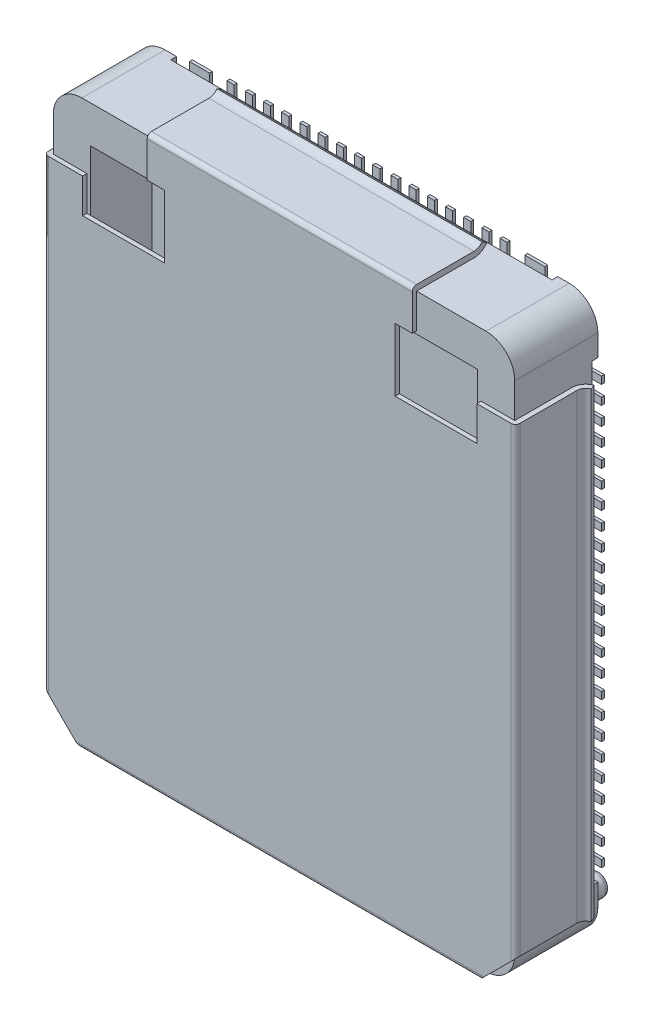
from build123d import *

# Parameters (mm, degrees)
BASE_START                        = 0.2
BASE_DEPTH                        = 5.8
ESQUISSE2_W                       = 27
ESQUISSE2_H                       = 33.5
LOGEMENT_MODULE_DEPTH             = 4.3
PASSAGE_PINS_X_DEPTH              = 26.877258356
PASSAGE_PINS_X_DEPTH_BACK         = 26.877258356
ESQUISSE4_W                       = 26.6
ESQUISSE4_H                       = 1.2
PASSAGE_PINS_Y_DEPTH              = 26.877258356
PASSAGE_PINS_Y_DEPTH_BACK         = 26.877258356
ESQUISSE5_W                       = 1.2
ESQUISSE5_H                       = 31.7
PIN1_START                        = 14.605
PIN1_DEPTH                        = 0.25
PIN_START                         = -9.525
PIN_80_DEPTH                      = 0.25
R_P_TITION_LIN_AIRE_PINS_Y_COUNT  = 24
R_P_TITION_LIN_AIRE_PINS_Y_PITCH  = 1.27
SYM_TRIE_START                    = 14.605
SYM_TRIE_PINS_Y_COPY_1_DEPTH      = 0.25
SYM_TRIE_PINS_Y_COPY_2_DEPTH      = 0.25
SYM_TRIE_PINS_Y_COPY_3_DEPTH      = 0.25
SYM_TRIE_PINS_Y_COPY_4_DEPTH      = 0.25
SYM_TRIE_PINS_Y_COPY_5_DEPTH      = 0.25
SYM_TRIE_PINS_Y_COPY_6_DEPTH      = 0.25
SYM_TRIE_PINS_Y_COPY_7_DEPTH      = 0.25
SYM_TRIE_PINS_Y_COPY_8_DEPTH      = 0.25
SYM_TRIE_PINS_Y_COPY_9_DEPTH      = 0.25
SYM_TRIE_PINS_Y_COPY_10_DEPTH     = 0.25
SYM_TRIE_PINS_Y_COPY_11_DEPTH     = 0.25
SYM_TRIE_PINS_Y_COPY_12_DEPTH     = 0.25
SYM_TRIE_PINS_Y_COPY_13_DEPTH     = 0.25
SYM_TRIE_PINS_Y_COPY_14_DEPTH     = 0.25
SYM_TRIE_PINS_Y_COPY_15_DEPTH     = 0.25
SYM_TRIE_PINS_Y_COPY_16_DEPTH     = 0.25
SYM_TRIE_PINS_Y_COPY_17_DEPTH     = 0.25
SYM_TRIE_PINS_Y_COPY_18_DEPTH     = 0.25
SYM_TRIE_PINS_Y_COPY_19_DEPTH     = 0.25
SYM_TRIE_PINS_Y_COPY_20_DEPTH     = 0.25
SYM_TRIE_PINS_Y_COPY_21_DEPTH     = 0.25
SYM_TRIE_PINS_Y_COPY_22_DEPTH     = 0.25
SYM_TRIE_PINS_Y_COPY_23_DEPTH     = 0.25
R_P_TITION_LIN_AIRE_PINS_X_COUNT  = 16
R_P_TITION_LIN_AIRE_PINS_X_PITCH  = 1.27
SYM_TRIE_START_2                  = -9.525
SYM_TRIE_PINS_X_COPY_1_DEPTH      = 0.25
SYM_TRIE_PINS_X_COPY_2_DEPTH      = 0.25
SYM_TRIE_PINS_X_COPY_3_DEPTH      = 0.25
SYM_TRIE_PINS_X_COPY_4_DEPTH      = 0.25
SYM_TRIE_PINS_X_COPY_5_DEPTH      = 0.25
SYM_TRIE_PINS_X_COPY_6_DEPTH      = 0.25
SYM_TRIE_PINS_X_COPY_7_DEPTH      = 0.25
SYM_TRIE_PINS_X_COPY_8_DEPTH      = 0.25
SYM_TRIE_PINS_X_COPY_9_DEPTH      = 0.25
SYM_TRIE_PINS_X_COPY_10_DEPTH     = 0.25
SYM_TRIE_PINS_X_COPY_11_DEPTH     = 0.25
SYM_TRIE_PINS_X_COPY_12_DEPTH     = 0.25
SYM_TRIE_PINS_X_COPY_13_DEPTH     = 0.25
SYM_TRIE_PINS_X_COPY_14_DEPTH     = 0.25
SYM_TRIE_PINS_X_COPY_15_DEPTH     = 0.25
PIN_START_2                       = -11.7
PIN_MECA_DEPTH                    = 0.7
SYM_TRIE_START_3                  = -11.7
SYM_TRIE_PINS_MECA_Y_COPY_1_DEPTH = 0.7
ESQUISSE8_R                       = 0.75
DETROMPEUR_DEPTH                  = 1.2
CONG_DETROMPEUR_R                 = 0.3
CONG_DETROMPEUR_OF_SYM_TRIE5_R    = 0.3
CAPOT_TOP_DEPTH                   = 0.3
CAPOT_COTE_X_DEPTH                = 14.95
CAPOT_COTE_X_DEPTH_BACK           = 17.25
BOSS_EXTRU_9_DEPTH                = 9.25
BOSS_EXTRU_9_DEPTH_BACK           = 9.25
BOSS_EXTRU_10_DEPTH               = 13.95
BOSS_EXTRU_10_DEPTH_BACK          = 13.95
CONG_2_R                          = 0.3


with BuildPart() as part:
    # Esquisse1 → base (new body)
    with BuildSketch(Plane.XY.offset(BASE_START)):
        with BuildLine():
            Line((-14.1, 19.35), (14.1, 19.35))
            ThreePointArc((14.1, 19.35), (15.514213562, 18.764213562), (16.1, 17.35))
            Line((16.1, 17.35), (16.1, -17.35))
            ThreePointArc((16.1, -17.35), (15.514213562, -18.764213562), (14.1, -19.35))
            Line((14.1, -19.35), (-14.1, -19.35))
            ThreePointArc((-14.1, -19.35), (-15.514213562, -18.764213562), (-16.1, -17.35))
            Line((-16.1, -17.35), (-16.1, 17.35))
            ThreePointArc((-16.1, 17.35), (-15.514213562, 18.764213562), (-14.1, 19.35))
        make_face()
    extrude(amount=BASE_DEPTH)

    # Esquisse2 → logement module (cut)
    with BuildSketch(Plane.XY.offset(6)):
        Rectangle(ESQUISSE2_W, ESQUISSE2_H)
    extrude(amount=-LOGEMENT_MODULE_DEPTH, mode=Mode.SUBTRACT)

    # Esquisse4 → passage pins x (cut, two sides: drawn at the far end of the back side and taken through both)
    with BuildSketch(Plane(origin=(0, 0, 0), x_dir=(1, 0, 0), z_dir=(0, 1, 0)).offset(-PASSAGE_PINS_X_DEPTH_BACK)):
        Rectangle(ESQUISSE4_W, ESQUISSE4_H)
    extrude(amount=PASSAGE_PINS_X_DEPTH + PASSAGE_PINS_X_DEPTH_BACK, mode=Mode.SUBTRACT)

    # Esquisse5 → passage pins y (cut, two sides: drawn at the far end of the back side and taken through both)
    with BuildSketch(Plane(origin=(0, 0, 0), x_dir=(0, 0, -1), z_dir=(1, 0, 0)).offset(-PASSAGE_PINS_Y_DEPTH_BACK)):
        Rectangle(ESQUISSE5_W, ESQUISSE5_H)
    extrude(amount=PASSAGE_PINS_Y_DEPTH + PASSAGE_PINS_Y_DEPTH_BACK, mode=Mode.SUBTRACT)

    # Esquisse3 → pin1 (add, symmetric)
    with BuildSketch(Plane(origin=(0, 0, 0), x_dir=(1, 0, 0), z_dir=(0, 1, 0)).offset(PIN1_START)):
        with BuildLine():
            Line((-14.65, -1.206619838), (-14.65, -0.3))
            ThreePointArc((-14.65, -0.3), (-14.737867966, -0.087867966), (-14.95, 0))
            Line((-14.95, 0), (-16.35, 0))
            Line((-16.35, 0), (-16.35, -0.2))
            Line((-16.35, -0.2), (-14.95, -0.2))
            ThreePointArc((-14.95, -0.2), (-14.879289322, -0.229289322), (-14.85, -0.3))
            Line((-14.85, -0.3), (-14.85, -1.206619838))
            Line((-14.85, -1.206619838), (-14.65, -1.206619838))
        make_face()
    pin1 = extrude(amount=PIN1_DEPTH, both=True)

    # Esquisse6 → pin 80 (add, symmetric)
    with BuildSketch(Plane(origin=(0, 0, 0), x_dir=(0, 0, -1), z_dir=(1, 0, 0)).offset(PIN_START)):
        with BuildLine():
            Line((-1.147220395, 17.95), (-0.307843019, 17.95))
            ThreePointArc((-0.307843019, 17.95), (-0.090165133, 18.040165133), (0, 18.257843019))
            Line((0, 18.257843019), (0, 19.65))
            Line((0, 19.65), (-0.2, 19.65))
            Line((-0.2, 19.65), (-0.2, 18.257843019))
            ThreePointArc((-0.2, 18.257843019), (-0.231586489, 18.181586489), (-0.307843019, 18.15))
            Line((-0.307843019, 18.15), (-1.147220395, 18.15))
            Line((-1.147220395, 18.15), (-1.147220395, 17.95))
        make_face()
    pin_80 = extrude(amount=PIN_80_DEPTH, both=True)

    # Répétition linéaire pins y: pin1 ×24
    with Locations(*[(0, -i * R_P_TITION_LIN_AIRE_PINS_Y_PITCH, 0) for i in range(1, R_P_TITION_LIN_AIRE_PINS_Y_COUNT)]):
        add(pin1)

    # Symétrie pins y: pin1 across plane
    add(pin1.mirror(Plane(origin=(0, 0, 0), x_dir=(0, 0, 1), z_dir=(1, 0, 0))))

    # Symétrie pins y copy 1 sketch → Symétrie pins y copy 1 (add, symmetric)
    with BuildSketch(Plane(origin=(0, -1.27, 0), x_dir=(-1, 0, 0), z_dir=(0, 1, 0)).offset(SYM_TRIE_START)):
        with BuildLine():
            Line((-14.65, 1.206619838), (-14.65, 0.3))
            ThreePointArc((-14.65, 0.3), (-14.737867966, 0.087867966), (-14.95, 0))
            Line((-14.95, 0), (-16.35, 0))
            Line((-16.35, 0), (-16.35, 0.2))
            Line((-16.35, 0.2), (-14.95, 0.2))
            ThreePointArc((-14.95, 0.2), (-14.879289322, 0.229289322), (-14.85, 0.3))
            Line((-14.85, 0.3), (-14.85, 1.206619838))
            Line((-14.85, 1.206619838), (-14.65, 1.206619838))
        make_face()
    extrude(amount=SYM_TRIE_PINS_Y_COPY_1_DEPTH, both=True)

    # Symétrie pins y copy 2 sketch → Symétrie pins y copy 2 (add, symmetric)
    with BuildSketch(Plane(origin=(0, -2.54, 0), x_dir=(-1, 0, 0), z_dir=(0, 1, 0)).offset(SYM_TRIE_START)):
        with BuildLine():
            Line((-14.65, 1.206619838), (-14.65, 0.3))
            ThreePointArc((-14.65, 0.3), (-14.737867966, 0.087867966), (-14.95, 0))
            Line((-14.95, 0), (-16.35, 0))
            Line((-16.35, 0), (-16.35, 0.2))
            Line((-16.35, 0.2), (-14.95, 0.2))
            ThreePointArc((-14.95, 0.2), (-14.879289322, 0.229289322), (-14.85, 0.3))
            Line((-14.85, 0.3), (-14.85, 1.206619838))
            Line((-14.85, 1.206619838), (-14.65, 1.206619838))
        make_face()
    extrude(amount=SYM_TRIE_PINS_Y_COPY_2_DEPTH, both=True)

    # Symétrie pins y copy 3 sketch → Symétrie pins y copy 3 (add, symmetric)
    with BuildSketch(Plane(origin=(0, -3.81, 0), x_dir=(-1, 0, 0), z_dir=(0, 1, 0)).offset(SYM_TRIE_START)):
        with BuildLine():
            Line((-14.65, 1.206619838), (-14.65, 0.3))
            ThreePointArc((-14.65, 0.3), (-14.737867966, 0.087867966), (-14.95, 0))
            Line((-14.95, 0), (-16.35, 0))
            Line((-16.35, 0), (-16.35, 0.2))
            Line((-16.35, 0.2), (-14.95, 0.2))
            ThreePointArc((-14.95, 0.2), (-14.879289322, 0.229289322), (-14.85, 0.3))
            Line((-14.85, 0.3), (-14.85, 1.206619838))
            Line((-14.85, 1.206619838), (-14.65, 1.206619838))
        make_face()
    extrude(amount=SYM_TRIE_PINS_Y_COPY_3_DEPTH, both=True)

    # Symétrie pins y copy 4 sketch → Symétrie pins y copy 4 (add, symmetric)
    with BuildSketch(Plane(origin=(0, -5.08, 0), x_dir=(-1, 0, 0), z_dir=(0, 1, 0)).offset(SYM_TRIE_START)):
        with BuildLine():
            Line((-14.65, 1.206619838), (-14.65, 0.3))
            ThreePointArc((-14.65, 0.3), (-14.737867966, 0.087867966), (-14.95, 0))
            Line((-14.95, 0), (-16.35, 0))
            Line((-16.35, 0), (-16.35, 0.2))
            Line((-16.35, 0.2), (-14.95, 0.2))
            ThreePointArc((-14.95, 0.2), (-14.879289322, 0.229289322), (-14.85, 0.3))
            Line((-14.85, 0.3), (-14.85, 1.206619838))
            Line((-14.85, 1.206619838), (-14.65, 1.206619838))
        make_face()
    extrude(amount=SYM_TRIE_PINS_Y_COPY_4_DEPTH, both=True)

    # Symétrie pins y copy 5 sketch → Symétrie pins y copy 5 (add, symmetric)
    with BuildSketch(Plane(origin=(0, -6.35, 0), x_dir=(-1, 0, 0), z_dir=(0, 1, 0)).offset(SYM_TRIE_START)):
        with BuildLine():
            Line((-14.65, 1.206619838), (-14.65, 0.3))
            ThreePointArc((-14.65, 0.3), (-14.737867966, 0.087867966), (-14.95, 0))
            Line((-14.95, 0), (-16.35, 0))
            Line((-16.35, 0), (-16.35, 0.2))
            Line((-16.35, 0.2), (-14.95, 0.2))
            ThreePointArc((-14.95, 0.2), (-14.879289322, 0.229289322), (-14.85, 0.3))
            Line((-14.85, 0.3), (-14.85, 1.206619838))
            Line((-14.85, 1.206619838), (-14.65, 1.206619838))
        make_face()
    extrude(amount=SYM_TRIE_PINS_Y_COPY_5_DEPTH, both=True)

    # Symétrie pins y copy 6 sketch → Symétrie pins y copy 6 (add, symmetric)
    with BuildSketch(Plane(origin=(0, -7.62, 0), x_dir=(-1, 0, 0), z_dir=(0, 1, 0)).offset(SYM_TRIE_START)):
        with BuildLine():
            Line((-14.65, 1.206619838), (-14.65, 0.3))
            ThreePointArc((-14.65, 0.3), (-14.737867966, 0.087867966), (-14.95, 0))
            Line((-14.95, 0), (-16.35, 0))
            Line((-16.35, 0), (-16.35, 0.2))
            Line((-16.35, 0.2), (-14.95, 0.2))
            ThreePointArc((-14.95, 0.2), (-14.879289322, 0.229289322), (-14.85, 0.3))
            Line((-14.85, 0.3), (-14.85, 1.206619838))
            Line((-14.85, 1.206619838), (-14.65, 1.206619838))
        make_face()
    extrude(amount=SYM_TRIE_PINS_Y_COPY_6_DEPTH, both=True)

    # Symétrie pins y copy 7 sketch → Symétrie pins y copy 7 (add, symmetric)
    with BuildSketch(Plane(origin=(0, -8.89, 0), x_dir=(-1, 0, 0), z_dir=(0, 1, 0)).offset(SYM_TRIE_START)):
        with BuildLine():
            Line((-14.65, 1.206619838), (-14.65, 0.3))
            ThreePointArc((-14.65, 0.3), (-14.737867966, 0.087867966), (-14.95, 0))
            Line((-14.95, 0), (-16.35, 0))
            Line((-16.35, 0), (-16.35, 0.2))
            Line((-16.35, 0.2), (-14.95, 0.2))
            ThreePointArc((-14.95, 0.2), (-14.879289322, 0.229289322), (-14.85, 0.3))
            Line((-14.85, 0.3), (-14.85, 1.206619838))
            Line((-14.85, 1.206619838), (-14.65, 1.206619838))
        make_face()
    extrude(amount=SYM_TRIE_PINS_Y_COPY_7_DEPTH, both=True)

    # Symétrie pins y copy 8 sketch → Symétrie pins y copy 8 (add, symmetric)
    with BuildSketch(Plane(origin=(0, -10.16, 0), x_dir=(-1, 0, 0), z_dir=(0, 1, 0)).offset(SYM_TRIE_START)):
        with BuildLine():
            Line((-14.65, 1.206619838), (-14.65, 0.3))
            ThreePointArc((-14.65, 0.3), (-14.737867966, 0.087867966), (-14.95, 0))
            Line((-14.95, 0), (-16.35, 0))
            Line((-16.35, 0), (-16.35, 0.2))
            Line((-16.35, 0.2), (-14.95, 0.2))
            ThreePointArc((-14.95, 0.2), (-14.879289322, 0.229289322), (-14.85, 0.3))
            Line((-14.85, 0.3), (-14.85, 1.206619838))
            Line((-14.85, 1.206619838), (-14.65, 1.206619838))
        make_face()
    extrude(amount=SYM_TRIE_PINS_Y_COPY_8_DEPTH, both=True)

    # Symétrie pins y copy 9 sketch → Symétrie pins y copy 9 (add, symmetric)
    with BuildSketch(Plane(origin=(0, -11.43, 0), x_dir=(-1, 0, 0), z_dir=(0, 1, 0)).offset(SYM_TRIE_START)):
        with BuildLine():
            Line((-14.65, 1.206619838), (-14.65, 0.3))
            ThreePointArc((-14.65, 0.3), (-14.737867966, 0.087867966), (-14.95, 0))
            Line((-14.95, 0), (-16.35, 0))
            Line((-16.35, 0), (-16.35, 0.2))
            Line((-16.35, 0.2), (-14.95, 0.2))
            ThreePointArc((-14.95, 0.2), (-14.879289322, 0.229289322), (-14.85, 0.3))
            Line((-14.85, 0.3), (-14.85, 1.206619838))
            Line((-14.85, 1.206619838), (-14.65, 1.206619838))
        make_face()
    extrude(amount=SYM_TRIE_PINS_Y_COPY_9_DEPTH, both=True)

    # Symétrie pins y copy 10 sketch → Symétrie pins y copy 10 (add, symmetric)
    with BuildSketch(Plane(origin=(0, -12.7, 0), x_dir=(-1, 0, 0), z_dir=(0, 1, 0)).offset(SYM_TRIE_START)):
        with BuildLine():
            Line((-14.65, 1.206619838), (-14.65, 0.3))
            ThreePointArc((-14.65, 0.3), (-14.737867966, 0.087867966), (-14.95, 0))
            Line((-14.95, 0), (-16.35, 0))
            Line((-16.35, 0), (-16.35, 0.2))
            Line((-16.35, 0.2), (-14.95, 0.2))
            ThreePointArc((-14.95, 0.2), (-14.879289322, 0.229289322), (-14.85, 0.3))
            Line((-14.85, 0.3), (-14.85, 1.206619838))
            Line((-14.85, 1.206619838), (-14.65, 1.206619838))
        make_face()
    extrude(amount=SYM_TRIE_PINS_Y_COPY_10_DEPTH, both=True)

    # Symétrie pins y copy 11 sketch → Symétrie pins y copy 11 (add, symmetric)
    with BuildSketch(Plane(origin=(0, -13.97, 0), x_dir=(-1, 0, 0), z_dir=(0, 1, 0)).offset(SYM_TRIE_START)):
        with BuildLine():
            Line((-14.65, 1.206619838), (-14.65, 0.3))
            ThreePointArc((-14.65, 0.3), (-14.737867966, 0.087867966), (-14.95, 0))
            Line((-14.95, 0), (-16.35, 0))
            Line((-16.35, 0), (-16.35, 0.2))
            Line((-16.35, 0.2), (-14.95, 0.2))
            ThreePointArc((-14.95, 0.2), (-14.879289322, 0.229289322), (-14.85, 0.3))
            Line((-14.85, 0.3), (-14.85, 1.206619838))
            Line((-14.85, 1.206619838), (-14.65, 1.206619838))
        make_face()
    extrude(amount=SYM_TRIE_PINS_Y_COPY_11_DEPTH, both=True)

    # Symétrie pins y copy 12 sketch → Symétrie pins y copy 12 (add, symmetric)
    with BuildSketch(Plane(origin=(0, -15.24, 0), x_dir=(-1, 0, 0), z_dir=(0, 1, 0)).offset(SYM_TRIE_START)):
        with BuildLine():
            Line((-14.65, 1.206619838), (-14.65, 0.3))
            ThreePointArc((-14.65, 0.3), (-14.737867966, 0.087867966), (-14.95, 0))
            Line((-14.95, 0), (-16.35, 0))
            Line((-16.35, 0), (-16.35, 0.2))
            Line((-16.35, 0.2), (-14.95, 0.2))
            ThreePointArc((-14.95, 0.2), (-14.879289322, 0.229289322), (-14.85, 0.3))
            Line((-14.85, 0.3), (-14.85, 1.206619838))
            Line((-14.85, 1.206619838), (-14.65, 1.206619838))
        make_face()
    extrude(amount=SYM_TRIE_PINS_Y_COPY_12_DEPTH, both=True)

    # Symétrie pins y copy 13 sketch → Symétrie pins y copy 13 (add, symmetric)
    with BuildSketch(Plane(origin=(0, -16.51, 0), x_dir=(-1, 0, 0), z_dir=(0, 1, 0)).offset(SYM_TRIE_START)):
        with BuildLine():
            Line((-14.65, 1.206619838), (-14.65, 0.3))
            ThreePointArc((-14.65, 0.3), (-14.737867966, 0.087867966), (-14.95, 0))
            Line((-14.95, 0), (-16.35, 0))
            Line((-16.35, 0), (-16.35, 0.2))
            Line((-16.35, 0.2), (-14.95, 0.2))
            ThreePointArc((-14.95, 0.2), (-14.879289322, 0.229289322), (-14.85, 0.3))
            Line((-14.85, 0.3), (-14.85, 1.206619838))
            Line((-14.85, 1.206619838), (-14.65, 1.206619838))
        make_face()
    extrude(amount=SYM_TRIE_PINS_Y_COPY_13_DEPTH, both=True)

    # Symétrie pins y copy 14 sketch → Symétrie pins y copy 14 (add, symmetric)
    with BuildSketch(Plane(origin=(0, -17.78, 0), x_dir=(-1, 0, 0), z_dir=(0, 1, 0)).offset(SYM_TRIE_START)):
        with BuildLine():
            Line((-14.65, 1.206619838), (-14.65, 0.3))
            ThreePointArc((-14.65, 0.3), (-14.737867966, 0.087867966), (-14.95, 0))
            Line((-14.95, 0), (-16.35, 0))
            Line((-16.35, 0), (-16.35, 0.2))
            Line((-16.35, 0.2), (-14.95, 0.2))
            ThreePointArc((-14.95, 0.2), (-14.879289322, 0.229289322), (-14.85, 0.3))
            Line((-14.85, 0.3), (-14.85, 1.206619838))
            Line((-14.85, 1.206619838), (-14.65, 1.206619838))
        make_face()
    extrude(amount=SYM_TRIE_PINS_Y_COPY_14_DEPTH, both=True)

    # Symétrie pins y copy 15 sketch → Symétrie pins y copy 15 (add, symmetric)
    with BuildSketch(Plane(origin=(0, -19.05, 0), x_dir=(-1, 0, 0), z_dir=(0, 1, 0)).offset(SYM_TRIE_START)):
        with BuildLine():
            Line((-14.65, 1.206619838), (-14.65, 0.3))
            ThreePointArc((-14.65, 0.3), (-14.737867966, 0.087867966), (-14.95, 0))
            Line((-14.95, 0), (-16.35, 0))
            Line((-16.35, 0), (-16.35, 0.2))
            Line((-16.35, 0.2), (-14.95, 0.2))
            ThreePointArc((-14.95, 0.2), (-14.879289322, 0.229289322), (-14.85, 0.3))
            Line((-14.85, 0.3), (-14.85, 1.206619838))
            Line((-14.85, 1.206619838), (-14.65, 1.206619838))
        make_face()
    extrude(amount=SYM_TRIE_PINS_Y_COPY_15_DEPTH, both=True)

    # Symétrie pins y copy 16 sketch → Symétrie pins y copy 16 (add, symmetric)
    with BuildSketch(Plane(origin=(0, -20.32, 0), x_dir=(-1, 0, 0), z_dir=(0, 1, 0)).offset(SYM_TRIE_START)):
        with BuildLine():
            Line((-14.65, 1.206619838), (-14.65, 0.3))
            ThreePointArc((-14.65, 0.3), (-14.737867966, 0.087867966), (-14.95, 0))
            Line((-14.95, 0), (-16.35, 0))
            Line((-16.35, 0), (-16.35, 0.2))
            Line((-16.35, 0.2), (-14.95, 0.2))
            ThreePointArc((-14.95, 0.2), (-14.879289322, 0.229289322), (-14.85, 0.3))
            Line((-14.85, 0.3), (-14.85, 1.206619838))
            Line((-14.85, 1.206619838), (-14.65, 1.206619838))
        make_face()
    extrude(amount=SYM_TRIE_PINS_Y_COPY_16_DEPTH, both=True)

    # Symétrie pins y copy 17 sketch → Symétrie pins y copy 17 (add, symmetric)
    with BuildSketch(Plane(origin=(0, -21.59, 0), x_dir=(-1, 0, 0), z_dir=(0, 1, 0)).offset(SYM_TRIE_START)):
        with BuildLine():
            Line((-14.65, 1.206619838), (-14.65, 0.3))
            ThreePointArc((-14.65, 0.3), (-14.737867966, 0.087867966), (-14.95, 0))
            Line((-14.95, 0), (-16.35, 0))
            Line((-16.35, 0), (-16.35, 0.2))
            Line((-16.35, 0.2), (-14.95, 0.2))
            ThreePointArc((-14.95, 0.2), (-14.879289322, 0.229289322), (-14.85, 0.3))
            Line((-14.85, 0.3), (-14.85, 1.206619838))
            Line((-14.85, 1.206619838), (-14.65, 1.206619838))
        make_face()
    extrude(amount=SYM_TRIE_PINS_Y_COPY_17_DEPTH, both=True)

    # Symétrie pins y copy 18 sketch → Symétrie pins y copy 18 (add, symmetric)
    with BuildSketch(Plane(origin=(0, -22.86, 0), x_dir=(-1, 0, 0), z_dir=(0, 1, 0)).offset(SYM_TRIE_START)):
        with BuildLine():
            Line((-14.65, 1.206619838), (-14.65, 0.3))
            ThreePointArc((-14.65, 0.3), (-14.737867966, 0.087867966), (-14.95, 0))
            Line((-14.95, 0), (-16.35, 0))
            Line((-16.35, 0), (-16.35, 0.2))
            Line((-16.35, 0.2), (-14.95, 0.2))
            ThreePointArc((-14.95, 0.2), (-14.879289322, 0.229289322), (-14.85, 0.3))
            Line((-14.85, 0.3), (-14.85, 1.206619838))
            Line((-14.85, 1.206619838), (-14.65, 1.206619838))
        make_face()
    extrude(amount=SYM_TRIE_PINS_Y_COPY_18_DEPTH, both=True)

    # Symétrie pins y copy 19 sketch → Symétrie pins y copy 19 (add, symmetric)
    with BuildSketch(Plane(origin=(0, -24.13, 0), x_dir=(-1, 0, 0), z_dir=(0, 1, 0)).offset(SYM_TRIE_START)):
        with BuildLine():
            Line((-14.65, 1.206619838), (-14.65, 0.3))
            ThreePointArc((-14.65, 0.3), (-14.737867966, 0.087867966), (-14.95, 0))
            Line((-14.95, 0), (-16.35, 0))
            Line((-16.35, 0), (-16.35, 0.2))
            Line((-16.35, 0.2), (-14.95, 0.2))
            ThreePointArc((-14.95, 0.2), (-14.879289322, 0.229289322), (-14.85, 0.3))
            Line((-14.85, 0.3), (-14.85, 1.206619838))
            Line((-14.85, 1.206619838), (-14.65, 1.206619838))
        make_face()
    extrude(amount=SYM_TRIE_PINS_Y_COPY_19_DEPTH, both=True)

    # Symétrie pins y copy 20 sketch → Symétrie pins y copy 20 (add, symmetric)
    with BuildSketch(Plane(origin=(0, -25.4, 0), x_dir=(-1, 0, 0), z_dir=(0, 1, 0)).offset(SYM_TRIE_START)):
        with BuildLine():
            Line((-14.65, 1.206619838), (-14.65, 0.3))
            ThreePointArc((-14.65, 0.3), (-14.737867966, 0.087867966), (-14.95, 0))
            Line((-14.95, 0), (-16.35, 0))
            Line((-16.35, 0), (-16.35, 0.2))
            Line((-16.35, 0.2), (-14.95, 0.2))
            ThreePointArc((-14.95, 0.2), (-14.879289322, 0.229289322), (-14.85, 0.3))
            Line((-14.85, 0.3), (-14.85, 1.206619838))
            Line((-14.85, 1.206619838), (-14.65, 1.206619838))
        make_face()
    extrude(amount=SYM_TRIE_PINS_Y_COPY_20_DEPTH, both=True)

    # Symétrie pins y copy 21 sketch → Symétrie pins y copy 21 (add, symmetric)
    with BuildSketch(Plane(origin=(0, -26.67, 0), x_dir=(-1, 0, 0), z_dir=(0, 1, 0)).offset(SYM_TRIE_START)):
        with BuildLine():
            Line((-14.65, 1.206619838), (-14.65, 0.3))
            ThreePointArc((-14.65, 0.3), (-14.737867966, 0.087867966), (-14.95, 0))
            Line((-14.95, 0), (-16.35, 0))
            Line((-16.35, 0), (-16.35, 0.2))
            Line((-16.35, 0.2), (-14.95, 0.2))
            ThreePointArc((-14.95, 0.2), (-14.879289322, 0.229289322), (-14.85, 0.3))
            Line((-14.85, 0.3), (-14.85, 1.206619838))
            Line((-14.85, 1.206619838), (-14.65, 1.206619838))
        make_face()
    extrude(amount=SYM_TRIE_PINS_Y_COPY_21_DEPTH, both=True)

    # Symétrie pins y copy 22 sketch → Symétrie pins y copy 22 (add, symmetric)
    with BuildSketch(Plane(origin=(0, -27.94, 0), x_dir=(-1, 0, 0), z_dir=(0, 1, 0)).offset(SYM_TRIE_START)):
        with BuildLine():
            Line((-14.65, 1.206619838), (-14.65, 0.3))
            ThreePointArc((-14.65, 0.3), (-14.737867966, 0.087867966), (-14.95, 0))
            Line((-14.95, 0), (-16.35, 0))
            Line((-16.35, 0), (-16.35, 0.2))
            Line((-16.35, 0.2), (-14.95, 0.2))
            ThreePointArc((-14.95, 0.2), (-14.879289322, 0.229289322), (-14.85, 0.3))
            Line((-14.85, 0.3), (-14.85, 1.206619838))
            Line((-14.85, 1.206619838), (-14.65, 1.206619838))
        make_face()
    extrude(amount=SYM_TRIE_PINS_Y_COPY_22_DEPTH, both=True)

    # Symétrie pins y copy 23 sketch → Symétrie pins y copy 23 (add, symmetric)
    with BuildSketch(Plane(origin=(0, -29.21, 0), x_dir=(-1, 0, 0), z_dir=(0, 1, 0)).offset(SYM_TRIE_START)):
        with BuildLine():
            Line((-14.65, 1.206619838), (-14.65, 0.3))
            ThreePointArc((-14.65, 0.3), (-14.737867966, 0.087867966), (-14.95, 0))
            Line((-14.95, 0), (-16.35, 0))
            Line((-16.35, 0), (-16.35, 0.2))
            Line((-16.35, 0.2), (-14.95, 0.2))
            ThreePointArc((-14.95, 0.2), (-14.879289322, 0.229289322), (-14.85, 0.3))
            Line((-14.85, 0.3), (-14.85, 1.206619838))
            Line((-14.85, 1.206619838), (-14.65, 1.206619838))
        make_face()
    extrude(amount=SYM_TRIE_PINS_Y_COPY_23_DEPTH, both=True)

    # Répétition linéaire pins x: pin 80 ×16
    with Locations(*[(i * R_P_TITION_LIN_AIRE_PINS_X_PITCH, 0, 0) for i in range(1, R_P_TITION_LIN_AIRE_PINS_X_COUNT)]):
        add(pin_80)

    # Symétrie pins x: pin 80 across plane
    add(pin_80.mirror(Plane.ZX))

    # Symétrie pins x copy 1 sketch → Symétrie pins x copy 1 (add, symmetric)
    with BuildSketch(Plane(origin=(1.27, 0, 0), x_dir=(0, 0, -1), z_dir=(1, 0, 0)).offset(SYM_TRIE_START_2)):
        with BuildLine():
            Line((-1.147220395, -17.95), (-0.307843019, -17.95))
            ThreePointArc((-0.307843019, -17.95), (-0.090165133, -18.040165133), (0, -18.257843019))
            Line((0, -18.257843019), (0, -19.65))
            Line((0, -19.65), (-0.2, -19.65))
            Line((-0.2, -19.65), (-0.2, -18.257843019))
            ThreePointArc((-0.2, -18.257843019), (-0.231586489, -18.181586489), (-0.307843019, -18.15))
            Line((-0.307843019, -18.15), (-1.147220395, -18.15))
            Line((-1.147220395, -18.15), (-1.147220395, -17.95))
        make_face()
    extrude(amount=SYM_TRIE_PINS_X_COPY_1_DEPTH, both=True)

    # Symétrie pins x copy 2 sketch → Symétrie pins x copy 2 (add, symmetric)
    with BuildSketch(Plane(origin=(2.54, 0, 0), x_dir=(0, 0, -1), z_dir=(1, 0, 0)).offset(SYM_TRIE_START_2)):
        with BuildLine():
            Line((-1.147220395, -17.95), (-0.307843019, -17.95))
            ThreePointArc((-0.307843019, -17.95), (-0.090165133, -18.040165133), (0, -18.257843019))
            Line((0, -18.257843019), (0, -19.65))
            Line((0, -19.65), (-0.2, -19.65))
            Line((-0.2, -19.65), (-0.2, -18.257843019))
            ThreePointArc((-0.2, -18.257843019), (-0.231586489, -18.181586489), (-0.307843019, -18.15))
            Line((-0.307843019, -18.15), (-1.147220395, -18.15))
            Line((-1.147220395, -18.15), (-1.147220395, -17.95))
        make_face()
    extrude(amount=SYM_TRIE_PINS_X_COPY_2_DEPTH, both=True)

    # Symétrie pins x copy 3 sketch → Symétrie pins x copy 3 (add, symmetric)
    with BuildSketch(Plane(origin=(3.81, 0, 0), x_dir=(0, 0, -1), z_dir=(1, 0, 0)).offset(SYM_TRIE_START_2)):
        with BuildLine():
            Line((-1.147220395, -17.95), (-0.307843019, -17.95))
            ThreePointArc((-0.307843019, -17.95), (-0.090165133, -18.040165133), (0, -18.257843019))
            Line((0, -18.257843019), (0, -19.65))
            Line((0, -19.65), (-0.2, -19.65))
            Line((-0.2, -19.65), (-0.2, -18.257843019))
            ThreePointArc((-0.2, -18.257843019), (-0.231586489, -18.181586489), (-0.307843019, -18.15))
            Line((-0.307843019, -18.15), (-1.147220395, -18.15))
            Line((-1.147220395, -18.15), (-1.147220395, -17.95))
        make_face()
    extrude(amount=SYM_TRIE_PINS_X_COPY_3_DEPTH, both=True)

    # Symétrie pins x copy 4 sketch → Symétrie pins x copy 4 (add, symmetric)
    with BuildSketch(Plane(origin=(5.08, 0, 0), x_dir=(0, 0, -1), z_dir=(1, 0, 0)).offset(SYM_TRIE_START_2)):
        with BuildLine():
            Line((-1.147220395, -17.95), (-0.307843019, -17.95))
            ThreePointArc((-0.307843019, -17.95), (-0.090165133, -18.040165133), (0, -18.257843019))
            Line((0, -18.257843019), (0, -19.65))
            Line((0, -19.65), (-0.2, -19.65))
            Line((-0.2, -19.65), (-0.2, -18.257843019))
            ThreePointArc((-0.2, -18.257843019), (-0.231586489, -18.181586489), (-0.307843019, -18.15))
            Line((-0.307843019, -18.15), (-1.147220395, -18.15))
            Line((-1.147220395, -18.15), (-1.147220395, -17.95))
        make_face()
    extrude(amount=SYM_TRIE_PINS_X_COPY_4_DEPTH, both=True)

    # Symétrie pins x copy 5 sketch → Symétrie pins x copy 5 (add, symmetric)
    with BuildSketch(Plane(origin=(6.35, 0, 0), x_dir=(0, 0, -1), z_dir=(1, 0, 0)).offset(SYM_TRIE_START_2)):
        with BuildLine():
            Line((-1.147220395, -17.95), (-0.307843019, -17.95))
            ThreePointArc((-0.307843019, -17.95), (-0.090165133, -18.040165133), (0, -18.257843019))
            Line((0, -18.257843019), (0, -19.65))
            Line((0, -19.65), (-0.2, -19.65))
            Line((-0.2, -19.65), (-0.2, -18.257843019))
            ThreePointArc((-0.2, -18.257843019), (-0.231586489, -18.181586489), (-0.307843019, -18.15))
            Line((-0.307843019, -18.15), (-1.147220395, -18.15))
            Line((-1.147220395, -18.15), (-1.147220395, -17.95))
        make_face()
    extrude(amount=SYM_TRIE_PINS_X_COPY_5_DEPTH, both=True)

    # Symétrie pins x copy 6 sketch → Symétrie pins x copy 6 (add, symmetric)
    with BuildSketch(Plane(origin=(7.62, 0, 0), x_dir=(0, 0, -1), z_dir=(1, 0, 0)).offset(SYM_TRIE_START_2)):
        with BuildLine():
            Line((-1.147220395, -17.95), (-0.307843019, -17.95))
            ThreePointArc((-0.307843019, -17.95), (-0.090165133, -18.040165133), (0, -18.257843019))
            Line((0, -18.257843019), (0, -19.65))
            Line((0, -19.65), (-0.2, -19.65))
            Line((-0.2, -19.65), (-0.2, -18.257843019))
            ThreePointArc((-0.2, -18.257843019), (-0.231586489, -18.181586489), (-0.307843019, -18.15))
            Line((-0.307843019, -18.15), (-1.147220395, -18.15))
            Line((-1.147220395, -18.15), (-1.147220395, -17.95))
        make_face()
    extrude(amount=SYM_TRIE_PINS_X_COPY_6_DEPTH, both=True)

    # Symétrie pins x copy 7 sketch → Symétrie pins x copy 7 (add, symmetric)
    with BuildSketch(Plane(origin=(8.89, 0, 0), x_dir=(0, 0, -1), z_dir=(1, 0, 0)).offset(SYM_TRIE_START_2)):
        with BuildLine():
            Line((-1.147220395, -17.95), (-0.307843019, -17.95))
            ThreePointArc((-0.307843019, -17.95), (-0.090165133, -18.040165133), (0, -18.257843019))
            Line((0, -18.257843019), (0, -19.65))
            Line((0, -19.65), (-0.2, -19.65))
            Line((-0.2, -19.65), (-0.2, -18.257843019))
            ThreePointArc((-0.2, -18.257843019), (-0.231586489, -18.181586489), (-0.307843019, -18.15))
            Line((-0.307843019, -18.15), (-1.147220395, -18.15))
            Line((-1.147220395, -18.15), (-1.147220395, -17.95))
        make_face()
    extrude(amount=SYM_TRIE_PINS_X_COPY_7_DEPTH, both=True)

    # Symétrie pins x copy 8 sketch → Symétrie pins x copy 8 (add, symmetric)
    with BuildSketch(Plane(origin=(10.16, 0, 0), x_dir=(0, 0, -1), z_dir=(1, 0, 0)).offset(SYM_TRIE_START_2)):
        with BuildLine():
            Line((-1.147220395, -17.95), (-0.307843019, -17.95))
            ThreePointArc((-0.307843019, -17.95), (-0.090165133, -18.040165133), (0, -18.257843019))
            Line((0, -18.257843019), (0, -19.65))
            Line((0, -19.65), (-0.2, -19.65))
            Line((-0.2, -19.65), (-0.2, -18.257843019))
            ThreePointArc((-0.2, -18.257843019), (-0.231586489, -18.181586489), (-0.307843019, -18.15))
            Line((-0.307843019, -18.15), (-1.147220395, -18.15))
            Line((-1.147220395, -18.15), (-1.147220395, -17.95))
        make_face()
    extrude(amount=SYM_TRIE_PINS_X_COPY_8_DEPTH, both=True)

    # Symétrie pins x copy 9 sketch → Symétrie pins x copy 9 (add, symmetric)
    with BuildSketch(Plane(origin=(11.43, 0, 0), x_dir=(0, 0, -1), z_dir=(1, 0, 0)).offset(SYM_TRIE_START_2)):
        with BuildLine():
            Line((-1.147220395, -17.95), (-0.307843019, -17.95))
            ThreePointArc((-0.307843019, -17.95), (-0.090165133, -18.040165133), (0, -18.257843019))
            Line((0, -18.257843019), (0, -19.65))
            Line((0, -19.65), (-0.2, -19.65))
            Line((-0.2, -19.65), (-0.2, -18.257843019))
            ThreePointArc((-0.2, -18.257843019), (-0.231586489, -18.181586489), (-0.307843019, -18.15))
            Line((-0.307843019, -18.15), (-1.147220395, -18.15))
            Line((-1.147220395, -18.15), (-1.147220395, -17.95))
        make_face()
    extrude(amount=SYM_TRIE_PINS_X_COPY_9_DEPTH, both=True)

    # Symétrie pins x copy 10 sketch → Symétrie pins x copy 10 (add, symmetric)
    with BuildSketch(Plane(origin=(12.7, 0, 0), x_dir=(0, 0, -1), z_dir=(1, 0, 0)).offset(SYM_TRIE_START_2)):
        with BuildLine():
            Line((-1.147220395, -17.95), (-0.307843019, -17.95))
            ThreePointArc((-0.307843019, -17.95), (-0.090165133, -18.040165133), (0, -18.257843019))
            Line((0, -18.257843019), (0, -19.65))
            Line((0, -19.65), (-0.2, -19.65))
            Line((-0.2, -19.65), (-0.2, -18.257843019))
            ThreePointArc((-0.2, -18.257843019), (-0.231586489, -18.181586489), (-0.307843019, -18.15))
            Line((-0.307843019, -18.15), (-1.147220395, -18.15))
            Line((-1.147220395, -18.15), (-1.147220395, -17.95))
        make_face()
    extrude(amount=SYM_TRIE_PINS_X_COPY_10_DEPTH, both=True)

    # Symétrie pins x copy 11 sketch → Symétrie pins x copy 11 (add, symmetric)
    with BuildSketch(Plane(origin=(13.97, 0, 0), x_dir=(0, 0, -1), z_dir=(1, 0, 0)).offset(SYM_TRIE_START_2)):
        with BuildLine():
            Line((-1.147220395, -17.95), (-0.307843019, -17.95))
            ThreePointArc((-0.307843019, -17.95), (-0.090165133, -18.040165133), (0, -18.257843019))
            Line((0, -18.257843019), (0, -19.65))
            Line((0, -19.65), (-0.2, -19.65))
            Line((-0.2, -19.65), (-0.2, -18.257843019))
            ThreePointArc((-0.2, -18.257843019), (-0.231586489, -18.181586489), (-0.307843019, -18.15))
            Line((-0.307843019, -18.15), (-1.147220395, -18.15))
            Line((-1.147220395, -18.15), (-1.147220395, -17.95))
        make_face()
    extrude(amount=SYM_TRIE_PINS_X_COPY_11_DEPTH, both=True)

    # Symétrie pins x copy 12 sketch → Symétrie pins x copy 12 (add, symmetric)
    with BuildSketch(Plane(origin=(15.24, 0, 0), x_dir=(0, 0, -1), z_dir=(1, 0, 0)).offset(SYM_TRIE_START_2)):
        with BuildLine():
            Line((-1.147220395, -17.95), (-0.307843019, -17.95))
            ThreePointArc((-0.307843019, -17.95), (-0.090165133, -18.040165133), (0, -18.257843019))
            Line((0, -18.257843019), (0, -19.65))
            Line((0, -19.65), (-0.2, -19.65))
            Line((-0.2, -19.65), (-0.2, -18.257843019))
            ThreePointArc((-0.2, -18.257843019), (-0.231586489, -18.181586489), (-0.307843019, -18.15))
            Line((-0.307843019, -18.15), (-1.147220395, -18.15))
            Line((-1.147220395, -18.15), (-1.147220395, -17.95))
        make_face()
    extrude(amount=SYM_TRIE_PINS_X_COPY_12_DEPTH, both=True)

    # Symétrie pins x copy 13 sketch → Symétrie pins x copy 13 (add, symmetric)
    with BuildSketch(Plane(origin=(16.51, 0, 0), x_dir=(0, 0, -1), z_dir=(1, 0, 0)).offset(SYM_TRIE_START_2)):
        with BuildLine():
            Line((-1.147220395, -17.95), (-0.307843019, -17.95))
            ThreePointArc((-0.307843019, -17.95), (-0.090165133, -18.040165133), (0, -18.257843019))
            Line((0, -18.257843019), (0, -19.65))
            Line((0, -19.65), (-0.2, -19.65))
            Line((-0.2, -19.65), (-0.2, -18.257843019))
            ThreePointArc((-0.2, -18.257843019), (-0.231586489, -18.181586489), (-0.307843019, -18.15))
            Line((-0.307843019, -18.15), (-1.147220395, -18.15))
            Line((-1.147220395, -18.15), (-1.147220395, -17.95))
        make_face()
    extrude(amount=SYM_TRIE_PINS_X_COPY_13_DEPTH, both=True)

    # Symétrie pins x copy 14 sketch → Symétrie pins x copy 14 (add, symmetric)
    with BuildSketch(Plane(origin=(17.78, 0, 0), x_dir=(0, 0, -1), z_dir=(1, 0, 0)).offset(SYM_TRIE_START_2)):
        with BuildLine():
            Line((-1.147220395, -17.95), (-0.307843019, -17.95))
            ThreePointArc((-0.307843019, -17.95), (-0.090165133, -18.040165133), (0, -18.257843019))
            Line((0, -18.257843019), (0, -19.65))
            Line((0, -19.65), (-0.2, -19.65))
            Line((-0.2, -19.65), (-0.2, -18.257843019))
            ThreePointArc((-0.2, -18.257843019), (-0.231586489, -18.181586489), (-0.307843019, -18.15))
            Line((-0.307843019, -18.15), (-1.147220395, -18.15))
            Line((-1.147220395, -18.15), (-1.147220395, -17.95))
        make_face()
    extrude(amount=SYM_TRIE_PINS_X_COPY_14_DEPTH, both=True)

    # Symétrie pins x copy 15 sketch → Symétrie pins x copy 15 (add, symmetric)
    with BuildSketch(Plane(origin=(19.05, 0, 0), x_dir=(0, 0, -1), z_dir=(1, 0, 0)).offset(SYM_TRIE_START_2)):
        with BuildLine():
            Line((-1.147220395, -17.95), (-0.307843019, -17.95))
            ThreePointArc((-0.307843019, -17.95), (-0.090165133, -18.040165133), (0, -18.257843019))
            Line((0, -18.257843019), (0, -19.65))
            Line((0, -19.65), (-0.2, -19.65))
            Line((-0.2, -19.65), (-0.2, -18.257843019))
            ThreePointArc((-0.2, -18.257843019), (-0.231586489, -18.181586489), (-0.307843019, -18.15))
            Line((-0.307843019, -18.15), (-1.147220395, -18.15))
            Line((-1.147220395, -18.15), (-1.147220395, -17.95))
        make_face()
    extrude(amount=SYM_TRIE_PINS_X_COPY_15_DEPTH, both=True)

    # Esquisse7 → pin meca (add, symmetric)
    with BuildSketch(Plane(origin=(0, 0, 0), x_dir=(0, 0, -1), z_dir=(1, 0, 0)).offset(PIN_START_2)):
        with BuildLine():
            Line((0, 19.5), (0, 18.257843019))
            ThreePointArc((0, 18.257843019), (-0.075520472, 18.075520472), (-0.257843019, 18))
            Line((-0.257843019, 18), (-6, 18))
            Line((-6, 18), (-6, 18.2))
            Line((-6, 18.2), (-0.257843019, 18.2))
            ThreePointArc((-0.257843019, 18.2), (-0.216941828, 18.216941828), (-0.2, 18.257843019))
            Line((-0.2, 18.257843019), (-0.2, 19.5))
            Line((-0.2, 19.5), (0, 19.5))
        make_face()
    pin_meca = extrude(amount=PIN_MECA_DEPTH, both=True)

    # Symétrie pins meca x: pin meca across plane
    add(pin_meca.mirror(Plane(origin=(0, 0, 0), x_dir=(0, 0, 1), z_dir=(1, 0, 0))))

    # Symétrie pins meca y: pin meca across plane
    add(pin_meca.mirror(Plane.ZX))

    # Symétrie pins meca y copy 1 sketch → Symétrie pins meca y copy 1 (add, symmetric)
    with BuildSketch(Plane(origin=(0, 0, 0), x_dir=(0, 0, -1), z_dir=(-1, 0, 0)).offset(SYM_TRIE_START_3)):
        with BuildLine():
            Line((0, 19.5), (0, 18.257843019))
            ThreePointArc((0, 18.257843019), (-0.075520472, 18.075520472), (-0.257843019, 18))
            Line((-0.257843019, 18), (-6, 18))
            Line((-6, 18), (-6, 18.2))
            Line((-6, 18.2), (-0.257843019, 18.2))
            ThreePointArc((-0.257843019, 18.2), (-0.216941828, 18.216941828), (-0.2, 18.257843019))
            Line((-0.2, 18.257843019), (-0.2, 19.5))
            Line((-0.2, 19.5), (0, 19.5))
        make_face()
    extrude(amount=SYM_TRIE_PINS_MECA_Y_COPY_1_DEPTH, both=True)

    # Esquisse8 → detrompeur (add)
    with BuildSketch(Plane(origin=(0, 0, 0.2), x_dir=(-1, 0, 0), z_dir=(0, 0, -1))):
        with Locations((-15, -17)):
            Circle(ESQUISSE8_R)
    detrompeur = extrude(amount=DETROMPEUR_DEPTH)

    # Congé detrompeur
    cong_detrompeur_edges = [part.edges().sort_by_distance(p)[0] for p in [
        (15.75, -17, -1),
    ]]
    fillet(cong_detrompeur_edges, radius=CONG_DETROMPEUR_R)

    # Symétrie5: detrompeur across plane
    add(detrompeur.mirror(Plane(origin=(0, 0, 0), x_dir=(0, 0, 1), z_dir=(1, 0, 0))))

    # Congé detrompeur of Symétrie5
    cong_detrompeur_of_sym_trie5_edges = [part.edges().sort_by_distance(p)[0] for p in [
        (-15.75, -17, -1),
    ]]
    fillet(cong_detrompeur_of_sym_trie5_edges, radius=CONG_DETROMPEUR_OF_SYM_TRIE5_R)

    # Esquisse9 → capot top (add)
    with BuildSketch(Plane.XY.offset(6)):
        Polygon((-9.25, 19.75), (-9.25, 16.95), (-8.05, 16.95), (-8.05, 12.55), (-13.75, 12.55), (-13.75, 14.95), (-16.45, 14.95), (-16.45, -17.25), (-13.95, -19.75), (13.95, -19.75), (16.45, -17.25), (16.45, 14.95), (13.75, 14.95), (13.75, 12.55), (8.05, 12.55), (8.05, 16.95), (9.25, 16.95), (9.25, 19.75), align=None)
    extrude(amount=CAPOT_TOP_DEPTH)

    # Esquisse10 → capot cote x (add, two sides: drawn at the far end of the back side and taken through both)
    with BuildSketch(Plane(origin=(0, 0, 0), x_dir=(1, 0, 0), z_dir=(0, 1, 0)).offset(-CAPOT_COTE_X_DEPTH_BACK)):
        with BuildLine():
            Line((16.1, -6), (16.1, -2))
            ThreePointArc((16.1, -2), (16.273274683, -1.450591682), (16.730395114, -1.1))
            Line((16.730395114, -1.1), (16.85, -1.428929584))
            ThreePointArc((16.85, -1.428929584), (16.559946717, -1.651387959), (16.45, -2))
            Line((16.45, -2), (16.45, -6))
            Line((16.45, -6), (16.1, -6))
        make_face()
        with BuildLine():
            Line((-16.45, -6), (-16.1, -6))
            Line((-16.1, -6), (-16.1, -2))
            ThreePointArc((-16.1, -2), (-16.273274683, -1.450591682), (-16.730395114, -1.1))
            Line((-16.730395114, -1.1), (-16.85, -1.428929584))
            ThreePointArc((-16.85, -1.428929584), (-16.559946717, -1.651387959), (-16.45, -2))
            Line((-16.45, -2), (-16.45, -6))
        make_face()
    extrude(amount=CAPOT_COTE_X_DEPTH + CAPOT_COTE_X_DEPTH_BACK)

    # Esquisse11 → Boss.-Extru.9 (add, two sides: drawn at the far end of the back side and taken through both)
    with BuildSketch(Plane(origin=(0, 0, 0), x_dir=(0, 0, -1), z_dir=(1, 0, 0)).offset(-BOSS_EXTRU_9_DEPTH_BACK)):
        with BuildLine():
            Line((-6, 19.35), (-2, 19.35))
            ThreePointArc((-2, 19.35), (-1.491941961, 19.475068689), (-1.1, 19.821690452))
            Line((-1.1, 19.821690452), (-1.428929584, 20.049298292))
            ThreePointArc((-1.428929584, 20.049298292), (-1.677625649, 19.82935892), (-2, 19.75))
            Line((-2, 19.75), (-6, 19.75))
            Line((-6, 19.75), (-6, 19.35))
        make_face()
    extrude(amount=BOSS_EXTRU_9_DEPTH + BOSS_EXTRU_9_DEPTH_BACK)

    # Esquisse12 → Boss.-Extru.10 (add, two sides: drawn at the far end of the back side and taken through both)
    with BuildSketch(Plane(origin=(0, 0, 0), x_dir=(0, 0, -1), z_dir=(1, 0, 0)).offset(-BOSS_EXTRU_10_DEPTH_BACK)):
        with BuildLine():
            Line((-6, -19.35), (-2, -19.35))
            ThreePointArc((-2, -19.35), (-1.491941961, -19.475068689), (-1.1, -19.821690452))
            Line((-1.1, -19.821690452), (-1.428929584, -20.049298292))
            ThreePointArc((-1.428929584, -20.049298292), (-1.677625649, -19.82935892), (-2, -19.75))
            Line((-2, -19.75), (-6, -19.75))
            Line((-6, -19.75), (-6, -19.35))
        make_face()
    extrude(amount=BOSS_EXTRU_10_DEPTH + BOSS_EXTRU_10_DEPTH_BACK)

    # Congé2
    cong_2_edges = [part.edges().sort_by_distance(p)[0] for p in [
        (0, 19.75, 6.3),
        (-16.45, -1.15, 6.3),
        (0, -19.75, 6.3),
        (16.45, -1.15, 6.3),
    ]]
    fillet(cong_2_edges, radius=CONG_2_R)


solid = part.part
